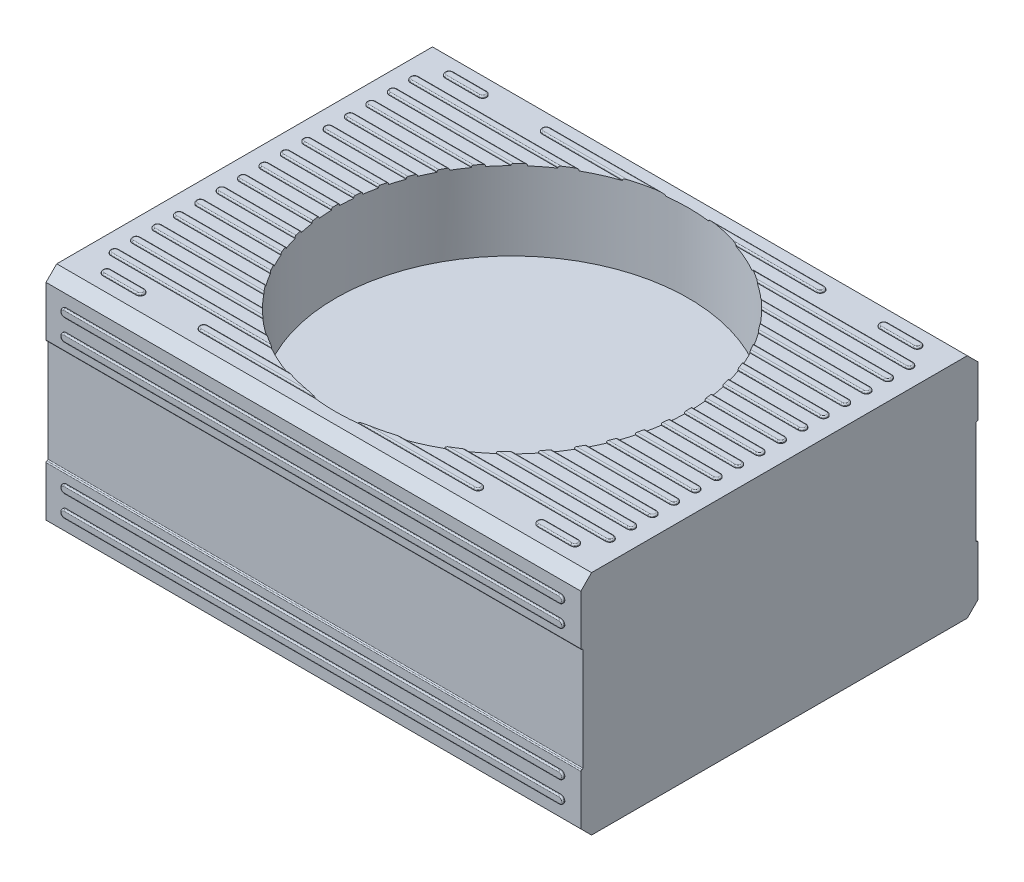
from build123d import *

# Parameters (mm, degrees)
SKETCH1_W           = 200
SKETCH1_H           = 148.5
BOSS_EXTRUDE1_DEPTH = 42.5
CHAMFER1_SIZE       = 4
BOSS_EXTRUDE2_DEPTH = 0.75
FILLET1_R           = 0.5
SKETCH2_R           = 66
CUT_EXTRUDE1_DEPTH  = 30
BOSS_EXTRUDE3_DEPTH = 0.75
BOSS_EXTRUDE4_DEPTH = 0.75
SKETCH6_W           = 200
SKETCH6_H           = 39
CUT_EXTRUDE2_DEPTH  = 0.75
FILLET2_R           = 0.5
FILLET3_R           = 0.375
SKETCH8_W           = 1.5
SKETCH8_H           = 4
SKETCH8_H_2         = 5
CUT_EXTRUDE3_DEPTH  = 17.5
BOSS_EXTRUDE5_START = 2.5
BOSS_EXTRUDE5_DEPTH = 2.5
SKETCH10_W          = 15
SKETCH10_H          = 20
BOSS_EXTRUDE6_DEPTH = 2
CUT_EXTRUDE4_DEPTH  = 10


with BuildPart() as part:
    # Sketch1 → Boss-Extrude1 (new, symmetric)
    with BuildSketch(Plane(origin=(0, 0, 0), x_dir=(1, 0, 0), z_dir=(0, 1, 0))):
        Rectangle(SKETCH1_W, SKETCH1_H)
    extrude(amount=BOSS_EXTRUDE1_DEPTH, both=True)

    # Chamfer1
    chamfer1_edges = [part.edges().sort_by_distance(p)[0] for p in [
        (0, 42.5, 74.25),
        (0, -42.5, 74.25),
        (0, -42.5, -74.25),
        (0, 42.5, -74.25),
    ]]
    chamfer(chamfer1_edges, length=CHAMFER1_SIZE)

    # Sketch3 → Boss-Extrude2 (add)
    with BuildSketch(Plane(origin=(0, 42.5, 0), x_dir=(1, 0, 0), z_dir=(0, 1, 0))):
        with BuildLine():
            Line((-92.5, 1.5), (92.5, 1.5))
            ThreePointArc((92.5, 1.5), (94, 0), (92.5, -1.5))
            Line((92.5, -1.5), (-92.5, -1.5))
            ThreePointArc((-92.5, -1.5), (-94, 0), (-92.5, 1.5))
        make_face()
        with BuildLine():
            Line((-92.5, 9.5), (92.5, 9.5))
            ThreePointArc((92.5, 9.5), (94, 8), (92.5, 6.5))
            Line((92.5, 6.5), (-92.5, 6.5))
            ThreePointArc((-92.5, 6.5), (-94, 8), (-92.5, 9.5))
        make_face()
        with BuildLine():
            Line((-92.5, 17.5), (92.5, 17.5))
            ThreePointArc((92.5, 17.5), (94, 16), (92.5, 14.5))
            Line((92.5, 14.5), (-92.5, 14.5))
            ThreePointArc((-92.5, 14.5), (-94, 16), (-92.5, 17.5))
        make_face()
        with BuildLine():
            Line((-92.5, 25.5), (92.5, 25.5))
            ThreePointArc((92.5, 25.5), (94, 24), (92.5, 22.5))
            Line((92.5, 22.5), (-92.5, 22.5))
            ThreePointArc((-92.5, 22.5), (-94, 24), (-92.5, 25.5))
        make_face()
        with BuildLine():
            Line((-92.5, 33.5), (92.5, 33.5))
            ThreePointArc((92.5, 33.5), (94, 32), (92.5, 30.5))
            Line((92.5, 30.5), (-92.5, 30.5))
            ThreePointArc((-92.5, 30.5), (-94, 32), (-92.5, 33.5))
        make_face()
        with BuildLine():
            Line((-92.5, 41.5), (92.5, 41.5))
            ThreePointArc((92.5, 41.5), (94, 40), (92.5, 38.5))
            Line((92.5, 38.5), (-92.5, 38.5))
            ThreePointArc((-92.5, 38.5), (-94, 40), (-92.5, 41.5))
        make_face()
        with BuildLine():
            Line((-92.5, 49.5), (92.5, 49.5))
            ThreePointArc((92.5, 49.5), (94, 48), (92.5, 46.5))
            Line((92.5, 46.5), (-92.5, 46.5))
            ThreePointArc((-92.5, 46.5), (-94, 48), (-92.5, 49.5))
        make_face()
        with BuildLine():
            Line((-92.5, 57.5), (92.5, 57.5))
            ThreePointArc((92.5, 57.5), (94, 56), (92.5, 54.5))
            Line((92.5, 54.5), (-92.5, 54.5))
            ThreePointArc((-92.5, 54.5), (-94, 56), (-92.5, 57.5))
        make_face()
        with BuildLine():
            Line((-87.5, 65.5), (-75, 65.5))
            ThreePointArc((-75, 65.5), (-73.5, 64), (-75, 62.5))
            Line((-75, 62.5), (-87.5, 62.5))
            ThreePointArc((-87.5, 62.5), (-89, 64), (-87.5, 65.5))
        make_face()
        with BuildLine():
            Line((-51.25, 65.5), (51.25, 65.5))
            ThreePointArc((51.25, 65.5), (52.75, 64), (51.25, 62.5))
            Line((51.25, 62.5), (-51.25, 62.5))
            ThreePointArc((-51.25, 62.5), (-52.75, 64), (-51.25, 65.5))
        make_face()
        with BuildLine():
            Line((75, 65.5), (87.5, 65.5))
            ThreePointArc((87.5, 65.5), (89, 64), (87.5, 62.5))
            Line((87.5, 62.5), (75, 62.5))
            ThreePointArc((75, 62.5), (73.5, 64), (75, 65.5))
        make_face()
        with BuildLine():
            Line((-92.5, -9.5), (92.5, -9.5))
            ThreePointArc((92.5, -9.5), (94, -8), (92.5, -6.5))
            Line((92.5, -6.5), (-92.5, -6.5))
            ThreePointArc((-92.5, -6.5), (-94, -8), (-92.5, -9.5))
        make_face()
        with BuildLine():
            Line((-92.5, -17.5), (92.5, -17.5))
            ThreePointArc((92.5, -17.5), (94, -16), (92.5, -14.5))
            Line((92.5, -14.5), (-92.5, -14.5))
            ThreePointArc((-92.5, -14.5), (-94, -16), (-92.5, -17.5))
        make_face()
        with BuildLine():
            Line((-92.5, -25.5), (92.5, -25.5))
            ThreePointArc((92.5, -25.5), (94, -24), (92.5, -22.5))
            Line((92.5, -22.5), (-92.5, -22.5))
            ThreePointArc((-92.5, -22.5), (-94, -24), (-92.5, -25.5))
        make_face()
        with BuildLine():
            Line((-92.5, -33.5), (92.5, -33.5))
            ThreePointArc((92.5, -33.5), (94, -32), (92.5, -30.5))
            Line((92.5, -30.5), (-92.5, -30.5))
            ThreePointArc((-92.5, -30.5), (-94, -32), (-92.5, -33.5))
        make_face()
        with BuildLine():
            Line((-92.5, -41.5), (92.5, -41.5))
            ThreePointArc((92.5, -41.5), (94, -40), (92.5, -38.5))
            Line((92.5, -38.5), (-92.5, -38.5))
            ThreePointArc((-92.5, -38.5), (-94, -40), (-92.5, -41.5))
        make_face()
        with BuildLine():
            Line((-92.5, -49.5), (92.5, -49.5))
            ThreePointArc((92.5, -49.5), (94, -48), (92.5, -46.5))
            Line((92.5, -46.5), (-92.5, -46.5))
            ThreePointArc((-92.5, -46.5), (-94, -48), (-92.5, -49.5))
        make_face()
        with BuildLine():
            Line((-92.5, -57.5), (92.5, -57.5))
            ThreePointArc((92.5, -57.5), (94, -56), (92.5, -54.5))
            Line((92.5, -54.5), (-92.5, -54.5))
            ThreePointArc((-92.5, -54.5), (-94, -56), (-92.5, -57.5))
        make_face()
        with BuildLine():
            Line((-87.5, -65.5), (-75, -65.5))
            ThreePointArc((-75, -65.5), (-73.5, -64), (-75, -62.5))
            Line((-75, -62.5), (-87.5, -62.5))
            ThreePointArc((-87.5, -62.5), (-89, -64), (-87.5, -65.5))
        make_face()
        with BuildLine():
            Line((-51.25, -65.5), (51.25, -65.5))
            ThreePointArc((51.25, -65.5), (52.75, -64), (51.25, -62.5))
            Line((51.25, -62.5), (-51.25, -62.5))
            ThreePointArc((-51.25, -62.5), (-52.75, -64), (-51.25, -65.5))
        make_face()
        with BuildLine():
            Line((75, -65.5), (87.5, -65.5))
            ThreePointArc((87.5, -65.5), (89, -64), (87.5, -62.5))
            Line((87.5, -62.5), (75, -62.5))
            ThreePointArc((75, -62.5), (73.5, -64), (75, -65.5))
        make_face()
    extrude(amount=BOSS_EXTRUDE2_DEPTH)

    # Fillet1
    fillet1_edges = [part.edges().sort_by_distance(p)[0] for p in [
        (89, 43.25, -64),
        (81.25, 43.25, -65.5),
        (-89, 43.25, 64),
        (-81.25, 43.25, 65.5),
        (-73.5, 43.25, 64),
        (-81.25, 43.25, 62.5),
        (73.5, 43.25, 64),
        (81.25, 43.25, 65.5),
        (89, 43.25, 64),
        (81.25, 43.25, 62.5),
        (-52.75, 43.25, 64),
        (0, 43.25, 65.5),
        (52.75, 43.25, 64),
        (0, 43.25, 62.5),
        (-94, 43.25, 0),
        (0, 43.25, 1.5),
        (94, 43.25, 0),
        (0, 43.25, -1.5),
        (-94, 43.25, -8),
        (0, 43.25, -6.5),
        (94, 43.25, -8),
        (0, 43.25, -9.5),
        (-94, 43.25, -16),
        (0, 43.25, -14.5),
        (94, 43.25, -16),
        (0, 43.25, -17.5),
        (-94, 43.25, -24),
        (0, 43.25, -22.5),
        (94, 43.25, -24),
        (0, 43.25, -25.5),
        (-94, 43.25, -32),
        (0, 43.25, -30.5),
        (94, 43.25, -32),
        (0, 43.25, -33.5),
        (-94, 43.25, -40),
        (0, 43.25, -38.5),
        (94, 43.25, -40),
        (0, 43.25, -41.5),
        (-94, 43.25, -48),
        (0, 43.25, -46.5),
        (94, 43.25, -48),
        (0, 43.25, -49.5),
        (-94, 43.25, -56),
        (0, 43.25, -54.5),
        (94, 43.25, -56),
        (0, 43.25, -57.5),
        (-52.75, 43.25, -64),
        (0, 43.25, -62.5),
        (52.75, 43.25, -64),
        (0, 43.25, -65.5),
        (-94, 43.25, 8),
        (0, 43.25, 9.5),
        (94, 43.25, 8),
        (0, 43.25, 6.5),
        (-94, 43.25, 16),
        (0, 43.25, 17.5),
        (94, 43.25, 16),
        (0, 43.25, 14.5),
        (-94, 43.25, 24),
        (0, 43.25, 25.5),
        (94, 43.25, 24),
        (0, 43.25, 22.5),
        (-94, 43.25, 32),
        (0, 43.25, 33.5),
        (94, 43.25, 32),
        (0, 43.25, 30.5),
        (-94, 43.25, 40),
        (0, 43.25, 41.5),
        (94, 43.25, 40),
        (0, 43.25, 38.5),
        (-94, 43.25, 48),
        (0, 43.25, 49.5),
        (94, 43.25, 48),
        (0, 43.25, 46.5),
        (-94, 43.25, 56),
        (0, 43.25, 57.5),
        (94, 43.25, 56),
        (0, 43.25, 54.5),
        (-89, 43.25, -64),
        (-81.25, 43.25, -62.5),
        (-73.5, 43.25, -64),
        (-81.25, 43.25, -65.5),
        (73.5, 43.25, -64),
        (81.25, 43.25, -62.5),
    ]]
    fillet(fillet1_edges, radius=FILLET1_R)

    # Sketch2 → Cut-Extrude1 (cut)
    with BuildSketch(Plane(origin=(0, 43.25, 0), x_dir=(1, 0, 0), z_dir=(0, 1, 0))):
        with Locations(Location((0, 0, 0), (0, 0, 270))):
            Circle(SKETCH2_R)
    extrude(amount=-CUT_EXTRUDE1_DEPTH, mode=Mode.SUBTRACT)

    # Sketch4 → Boss-Extrude3 (add)
    with BuildSketch(Plane.XZ.offset(42.5)):
        with BuildLine():
            Line((-92.5, 26.25), (92.5, 26.25))
            ThreePointArc((92.5, 26.25), (94, 24.75), (92.5, 23.25))
            Line((92.5, 23.25), (-92.5, 23.25))
            ThreePointArc((-92.5, 23.25), (-94, 24.75), (-92.5, 26.25))
        make_face()
        with BuildLine():
            Line((-92.5, 34.25), (92.5, 34.25))
            ThreePointArc((92.5, 34.25), (94, 32.75), (92.5, 31.25))
            Line((92.5, 31.25), (-92.5, 31.25))
            ThreePointArc((-92.5, 31.25), (-94, 32.75), (-92.5, 34.25))
        make_face()
        with BuildLine():
            Line((-92.5, 42.25), (92.5, 42.25))
            ThreePointArc((92.5, 42.25), (94, 40.75), (92.5, 39.25))
            Line((92.5, 39.25), (-92.5, 39.25))
            ThreePointArc((-92.5, 39.25), (-94, 40.75), (-92.5, 42.25))
        make_face()
        with BuildLine():
            Line((-92.5, 50.25), (92.5, 50.25))
            ThreePointArc((92.5, 50.25), (94, 48.75), (92.5, 47.25))
            Line((92.5, 47.25), (-92.5, 47.25))
            ThreePointArc((-92.5, 47.25), (-94, 48.75), (-92.5, 50.25))
        make_face()
        with BuildLine():
            Line((-92.5, 58.25), (92.5, 58.25))
            ThreePointArc((92.5, 58.25), (94, 56.75), (92.5, 55.25))
            Line((92.5, 55.25), (-92.5, 55.25))
            ThreePointArc((-92.5, 55.25), (-94, 56.75), (-92.5, 58.25))
        make_face()
        with BuildLine():
            Line((-92.5, -26.25), (92.5, -26.25))
            ThreePointArc((92.5, -26.25), (94, -24.75), (92.5, -23.25))
            Line((92.5, -23.25), (-92.5, -23.25))
            ThreePointArc((-92.5, -23.25), (-94, -24.75), (-92.5, -26.25))
        make_face()
        with BuildLine():
            Line((-92.5, -34.25), (92.5, -34.25))
            ThreePointArc((92.5, -34.25), (94, -32.75), (92.5, -31.25))
            Line((92.5, -31.25), (-92.5, -31.25))
            ThreePointArc((-92.5, -31.25), (-94, -32.75), (-92.5, -34.25))
        make_face()
        with BuildLine():
            Line((-92.5, -42.25), (92.5, -42.25))
            ThreePointArc((92.5, -42.25), (94, -40.75), (92.5, -39.25))
            Line((92.5, -39.25), (-92.5, -39.25))
            ThreePointArc((-92.5, -39.25), (-94, -40.75), (-92.5, -42.25))
        make_face()
        with BuildLine():
            Line((-92.5, -50.25), (92.5, -50.25))
            ThreePointArc((92.5, -50.25), (94, -48.75), (92.5, -47.25))
            Line((92.5, -47.25), (-92.5, -47.25))
            ThreePointArc((-92.5, -47.25), (-94, -48.75), (-92.5, -50.25))
        make_face()
        with BuildLine():
            Line((-92.5, -58.25), (92.5, -58.25))
            ThreePointArc((92.5, -58.25), (94, -56.75), (92.5, -55.25))
            Line((92.5, -55.25), (-92.5, -55.25))
            ThreePointArc((-92.5, -55.25), (-94, -56.75), (-92.5, -58.25))
        make_face()
    extrude(amount=BOSS_EXTRUDE3_DEPTH)

    # Sketch5 → Boss-Extrude4 (add)
    with BuildSketch(Plane.XY.offset(74.25)):
        with BuildLine():
            Line((-92.5, 34), (92.5, 34))
            ThreePointArc((92.5, 34), (94, 32.5), (92.5, 31))
            Line((92.5, 31), (-92.5, 31))
            ThreePointArc((-92.5, 31), (-94, 32.5), (-92.5, 34))
        make_face()
        with BuildLine():
            Line((-92.5, 26), (92.5, 26))
            ThreePointArc((92.5, 26), (94, 24.5), (92.5, 23))
            Line((92.5, 23), (-92.5, 23))
            ThreePointArc((-92.5, 23), (-94, 24.5), (-92.5, 26))
        make_face()
        with BuildLine():
            Line((-92.5, -34), (92.5, -34))
            ThreePointArc((92.5, -34), (94, -32.5), (92.5, -31))
            Line((92.5, -31), (-92.5, -31))
            ThreePointArc((-92.5, -31), (-94, -32.5), (-92.5, -34))
        make_face()
        with BuildLine():
            Line((-92.5, -26), (92.5, -26))
            ThreePointArc((92.5, -26), (94, -24.5), (92.5, -23))
            Line((92.5, -23), (-92.5, -23))
            ThreePointArc((-92.5, -23), (-94, -24.5), (-92.5, -26))
        make_face()
    boss_extrude4 = extrude(amount=BOSS_EXTRUDE4_DEPTH)

    # Sketch6 → Cut-Extrude2 (cut)
    with BuildSketch(Plane.XY.offset(74.25)):
        Rectangle(SKETCH6_W, SKETCH6_H)
    cut_extrude2 = extrude(amount=-CUT_EXTRUDE2_DEPTH, mode=Mode.SUBTRACT)

    # Mirror1: Boss-Extrude4, Cut-Extrude2 across plane
    add(boss_extrude4.mirror(Plane.XY))
    add(cut_extrude2.mirror(Plane.XY), mode=Mode.SUBTRACT)

    # Fillet2
    fillet2_edges = [part.edges().sort_by_distance(p)[0] for p in [
        (-94, -43.25, 24.75),
        (0, -43.25, 23.25),
        (94, -43.25, 24.75),
        (0, -43.25, 26.25),
        (-94, -43.25, 32.75),
        (0, -43.25, 31.25),
        (94, -43.25, 32.75),
        (0, -43.25, 34.25),
        (-94, -43.25, 40.75),
        (0, -43.25, 39.25),
        (94, -43.25, 40.75),
        (0, -43.25, 42.25),
        (-94, -43.25, 48.75),
        (0, -43.25, 47.25),
        (94, -43.25, 48.75),
        (0, -43.25, 50.25),
        (-94, -43.25, 56.75),
        (0, -43.25, 55.25),
        (94, -43.25, 56.75),
        (0, -43.25, 58.25),
        (-94, -43.25, -24.75),
        (0, -43.25, -26.25),
        (94, -43.25, -24.75),
        (0, -43.25, -23.25),
        (-94, -43.25, -32.75),
        (0, -43.25, -34.25),
        (94, -43.25, -32.75),
        (0, -43.25, -31.25),
        (-94, -43.25, -40.75),
        (0, -43.25, -42.25),
        (94, -43.25, -40.75),
        (0, -43.25, -39.25),
        (-94, -43.25, -48.75),
        (0, -43.25, -50.25),
        (94, -43.25, -48.75),
        (0, -43.25, -47.25),
        (-94, -43.25, -56.75),
        (0, -43.25, -58.25),
        (94, -43.25, -56.75),
        (0, -43.25, -55.25),
        (-94, 32.5, 75),
        (0, 31, 75),
        (94, 32.5, 75),
        (0, 34, 75),
        (-94, 24.5, 75),
        (0, 23, 75),
        (94, 24.5, 75),
        (0, 26, 75),
        (-94, -32.5, 75),
        (0, -34, 75),
        (94, -32.5, 75),
        (0, -31, 75),
        (-94, -24.5, 75),
        (0, -26, 75),
        (94, -24.5, 75),
        (0, -23, 75),
        (-94, 32.5, -75),
        (0, 34, -75),
        (94, 32.5, -75),
        (0, 31, -75),
        (-94, 24.5, -75),
        (0, 26, -75),
        (94, 24.5, -75),
        (0, 23, -75),
        (-94, -32.5, -75),
        (0, -31, -75),
        (94, -32.5, -75),
        (0, -34, -75),
        (-94, -24.5, -75),
        (0, -23, -75),
        (94, -24.5, -75),
        (0, -26, -75),
    ]]
    fillet(fillet2_edges, radius=FILLET2_R)

    # Fillet3
    fillet3_edges = [part.edges().sort_by_distance(p)[0] for p in [
        (0, 19.5, 73.5),
        (0, -19.5, 73.5),
        (0, -19.5, -73.5),
        (0, 19.5, -73.5),
    ]]
    fillet(fillet3_edges, radius=FILLET3_R)
    fillet3_2_edges = [part.edges().sort_by_distance(p)[0] for p in [
        (0, 19.5, 74.25),
        (0, -19.5, 74.25),
        (0, -19.5, -74.25),
        (0, 19.5, -74.25),
    ]]
    fillet(fillet3_2_edges, radius=FILLET3_R - 0.0001)  # a hair under: the kernel refuses the full size

    # Sketch8 → Cut-Extrude3 (cut)
    with BuildSketch(Plane.ZY.offset(100)):
        with BuildLine():
            Line((41, 14.5), (56, 14.5))
            ThreePointArc((56, 14.5), (58.121320344, 13.621320344), (59, 11.5))
            Line((59, 11.5), (59, -11.5))
            ThreePointArc((59, -11.5), (58.121320344, -13.621320344), (56, -14.5))
            Line((56, -14.5), (41, -14.5))
            ThreePointArc((41, -14.5), (38.878679656, -13.621320344), (38, -11.5))
            Line((38, -11.5), (38, 11.5))
            ThreePointArc((38, 11.5), (38.878679656, 13.621320344), (41, 14.5))
        make_face()
        with Locations((44, 7.5)):
            Rectangle(SKETCH8_W, SKETCH8_H, mode=Mode.SUBTRACT)
        with Locations((44, -7.5)):
            Rectangle(SKETCH8_W, SKETCH8_H, mode=Mode.SUBTRACT)
        with Locations((53, 0)):
            Rectangle(SKETCH8_W, SKETCH8_H_2, mode=Mode.SUBTRACT)
    extrude(amount=-CUT_EXTRUDE3_DEPTH, mode=Mode.SUBTRACT)

    # Sketch9 → Boss-Extrude5 (add)
    with BuildSketch(Plane.ZY.offset(100).offset(BOSS_EXTRUDE5_START)):
        with BuildLine():
            Line((36, 18), (61, 18))
            ThreePointArc((61, 18), (62.060660172, 17.560660172), (62.5, 16.5))
            Line((62.5, 16.5), (62.5, -16.5))
            ThreePointArc((62.5, -16.5), (62.060660172, -17.560660172), (61, -18))
            Line((61, -18), (36, -18))
            ThreePointArc((36, -18), (34.939339828, -17.560660172), (34.5, -16.5))
            Line((34.5, -16.5), (34.5, 16.5))
            ThreePointArc((34.5, 16.5), (34.939339828, 17.560660172), (36, 18))
        make_face()
        with BuildLine():
            Line((41, -14.5), (56, -14.5))
            ThreePointArc((56, -14.5), (58.121320344, -13.621320344), (59, -11.5))
            Line((59, -11.5), (59, 11.5))
            ThreePointArc((59, 11.5), (58.121320344, 13.621320344), (56, 14.5))
            Line((56, 14.5), (41, 14.5))
            ThreePointArc((41, 14.5), (38.878679656, 13.621320344), (38, 11.5))
            Line((38, 11.5), (38, -11.5))
            ThreePointArc((38, -11.5), (38.878679656, -13.621320344), (41, -14.5))
        make_face(mode=Mode.SUBTRACT)
    extrude(amount=-BOSS_EXTRUDE5_DEPTH)

    # Sketch10 → Boss-Extrude6 (add)
    with BuildSketch(Plane.ZY.offset(100)):
        with Locations((21, 0)):
            Rectangle(SKETCH10_W, SKETCH10_H)
    extrude(amount=BOSS_EXTRUDE6_DEPTH)

    # Sketch11 → Cut-Extrude4 (cut)
    with BuildSketch(Plane.ZY.offset(102)):
        with BuildLine():
            ThreePointArc((16.929338222, 6.853290986), (15.971642659, 0), (16.929338222, -6.853290986))
            ThreePointArc((16.929338222, -6.853290986), (21, -7.719304305), (25.070661778, -6.853290986))
            ThreePointArc((25.070661778, -6.853290986), (26.028357341, 0), (25.070661778, 6.853290986))
            ThreePointArc((25.070661778, 6.853290986), (21, 7.719304305), (16.929338222, 6.853290986))
        make_face()
    extrude(amount=-CUT_EXTRUDE4_DEPTH, mode=Mode.SUBTRACT)


solid = part.part
